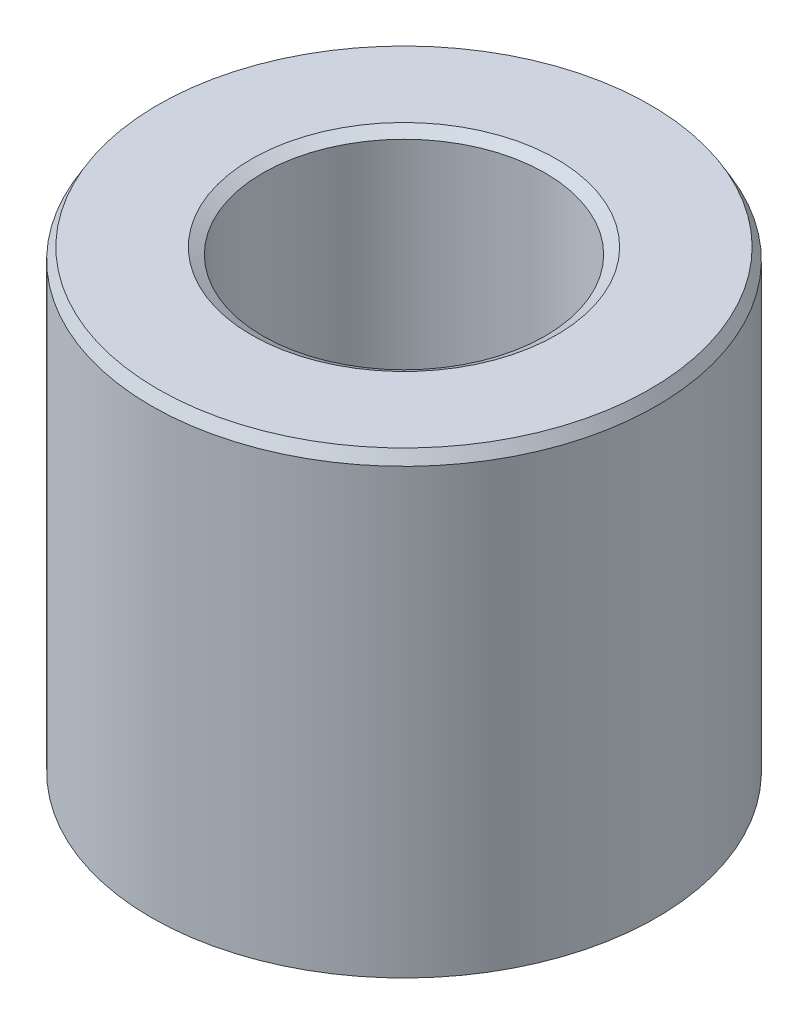
from build123d import *
from OCP.BRepFilletAPI import BRepFilletAPI_MakeChamfer

# Parameters (mm, degrees)
SKETCH1_R           = 42.5
BOSS_EXTRUDE1_DEPTH = 77.52421497
SKETCH2_R           = 23.747839223
CUT_EXTRUDE1_DEPTH  = 99.094362258
CHAMFER1_SIZE       = 1.900153051
CHAMFER1_SIZE2      = 1.097053875


with BuildPart() as part:
    # Sketch1 → Boss-Extrude1 (new body)
    with BuildSketch(Plane(origin=(0, 0, 0), x_dir=(1, 0, 0), z_dir=(0, 1, 0))):
        Circle(SKETCH1_R)
    extrude(amount=BOSS_EXTRUDE1_DEPTH)

    # Sketch2 → Cut-Extrude1 (cut, through all)
    with BuildSketch(Plane(origin=(0, 0, 0), x_dir=(1, 0, 0), z_dir=(0, 1, 0))):
        Circle(SKETCH2_R)
    extrude(amount=CUT_EXTRUDE1_DEPTH, mode=Mode.SUBTRACT)

    # Chamfer1: one chamfer whose edges measure the first distance from different faces: ONE call of the kernel's chamfer builder (chamfer() names one face for all edges)
    chamfer1_edges_1 = [part.edges().sort_by_distance(p)[0] for p in [
        (-23.747839223, 77.52421497, 0),
    ]]
    chamfer1_side_1 = [part.faces().sort_by_distance(p)[0] for p in [
        (-41.297918472, 77.52421497, 0),
    ]]
    chamfer1_edges_2 = [part.edges().sort_by_distance(p)[0] for p in [
        (-23.747839223, 0, 0),
    ]]
    chamfer1_side_2 = [part.faces().sort_by_distance(p)[0] for p in [
        (-23.747839223, 38.762107485, 0),
    ]]
    chamfer1_edges_3 = [part.edges().sort_by_distance(p)[0] for p in [
        (-42.5, 0, 0),
    ]]
    chamfer1_side_3 = [part.faces().sort_by_distance(p)[0] for p in [
        (-41.297918472, 0, 0),
    ]]
    chamfer1_edges_4 = [part.edges().sort_by_distance(p)[0] for p in [
        (-42.5, 77.52421497, 0),
    ]]
    chamfer1_side_4 = [part.faces().sort_by_distance(p)[0] for p in [
        (-42.5, 38.762107485, 0),
    ]]
    chamfer1 = BRepFilletAPI_MakeChamfer(part.part.solid().wrapped)
    for e in chamfer1_edges_1:
        chamfer1.Add(CHAMFER1_SIZE, CHAMFER1_SIZE2, e.wrapped, chamfer1_side_1[0].wrapped)  # the first distance lies on this face
    for e in chamfer1_edges_2:
        chamfer1.Add(CHAMFER1_SIZE, CHAMFER1_SIZE2, e.wrapped, chamfer1_side_2[0].wrapped)  # the first distance lies on this face
    for e in chamfer1_edges_3:
        chamfer1.Add(CHAMFER1_SIZE, CHAMFER1_SIZE2, e.wrapped, chamfer1_side_3[0].wrapped)  # the first distance lies on this face
    for e in chamfer1_edges_4:
        chamfer1.Add(CHAMFER1_SIZE, CHAMFER1_SIZE2, e.wrapped, chamfer1_side_4[0].wrapped)  # the first distance lies on this face
    add(Compound.cast(chamfer1.Shape()), mode=Mode.REPLACE)


solid = part.part
